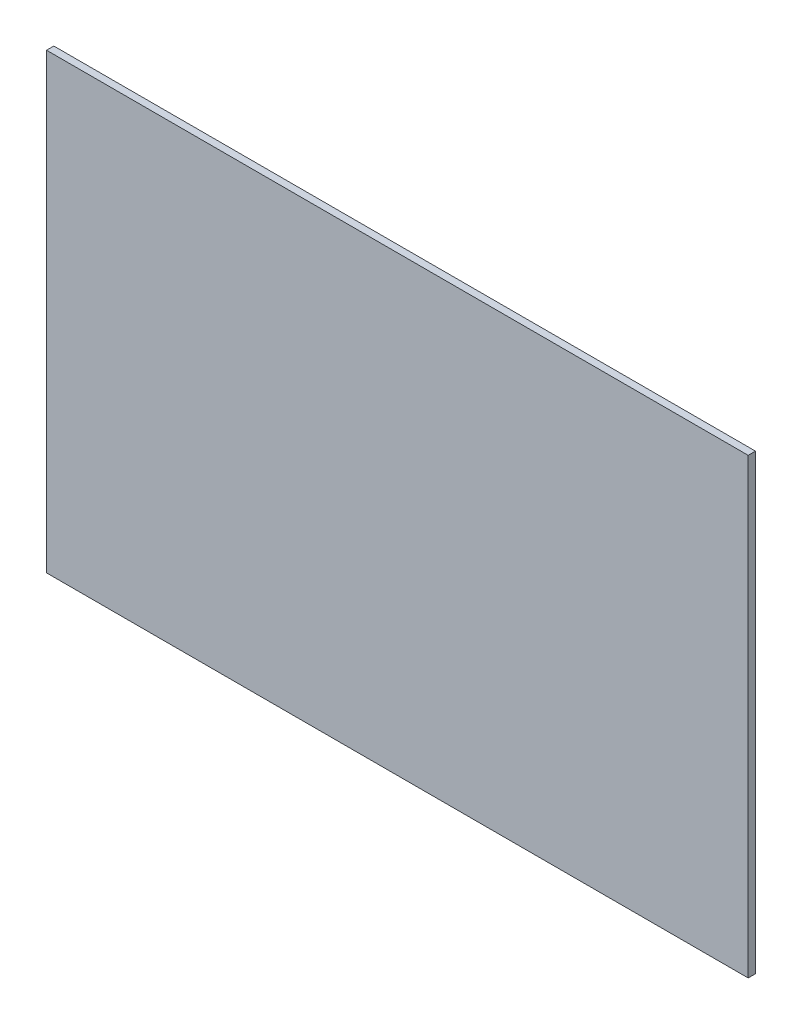
from build123d import *

# Parameters (mm, degrees)
SKETCH1_W           = 306.05
SKETCH1_H           = 197.425
BOSS_EXTRUDE1_DEPTH = 3.175


with BuildPart() as part:
    # Sketch1 → Boss-Extrude1 (new body)
    with BuildSketch(Plane.XY):
        Rectangle(SKETCH1_W, SKETCH1_H)
    extrude(amount=BOSS_EXTRUDE1_DEPTH)


solid = part.part
